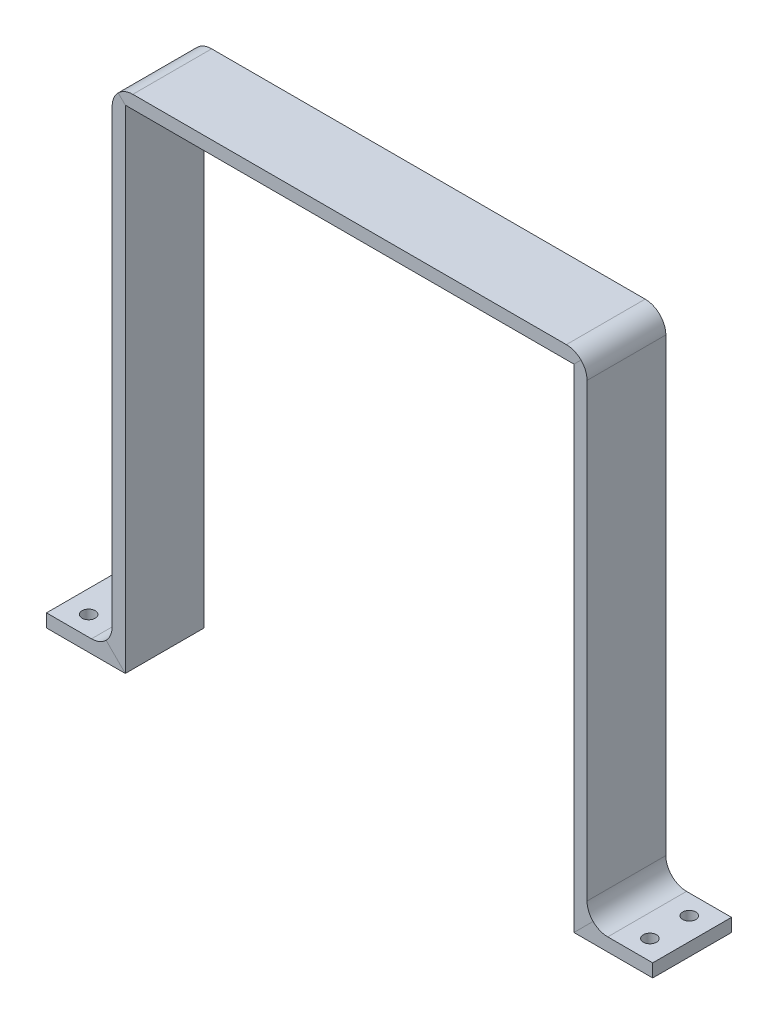
from build123d import *

# Parameters (mm, degrees)
SKETCH2_W            = 38.1
SKETCH2_H            = 6.35
FILLET1_R            = 10
CUT_EXTRUDE1_REACH   = 284.088
SKETCH3_R            = 3.175
FILLET1_OF_MIRROR1_R = 10


with BuildPart() as part:
    # Sweep1: sweep along a path in Sketch1
    with BuildLine(Plane.XY) as sweep1_path:
        Line((0, 0), (38.1, 0))
        Line((38.1, 0), (38.1, 237.998))
        Line((38.1, 237.998), (146.558, 237.998))
    # Sketch2 → Sweep1 (sweep)
    with BuildSketch(Plane(origin=(0, 0, 0), x_dir=(0, 0, -1), z_dir=(1, 0, 0))):
        with Locations((19.05, 3.175)):
            Rectangle(SKETCH2_W, SKETCH2_H)
    sweep1 = sweep(path=sweep1_path.line, transition=Transition.RIGHT)

    # Fillet1
    fillet1_edges = [part.edges().sort_by_distance(p)[0] for p in [
        (31.75, 6.35, -19.05),
        (31.75, 244.348, -19.05),
    ]]
    fillet(fillet1_edges, radius=FILLET1_R)

    # Sketch3 → Cut-Extrude1 (cut, up to next)
    with BuildSketch(Plane(origin=(0, 6.35, 0), x_dir=(1, 0, 0), z_dir=(0, 1, 0)), mode=Mode.PRIVATE) as cut_extrude1_sk1:
        with Locations((10.875, 28.575)):
            Circle(SKETCH3_R)
    cut_extrude1_tool1 = extrude(cut_extrude1_sk1.sketch, amount=-CUT_EXTRUDE1_REACH, mode=Mode.PRIVATE) & part.part
    # Sketch3 → Cut-Extrude1 (cut, up to next)
    with BuildSketch(Plane(origin=(0, 6.35, 0), x_dir=(1, 0, 0), z_dir=(0, 1, 0)), mode=Mode.PRIVATE) as cut_extrude1_sk2:
        with Locations((10.875, 9.525)):
            Circle(SKETCH3_R)
    cut_extrude1_tool2 = extrude(cut_extrude1_sk2.sketch, amount=-CUT_EXTRUDE1_REACH, mode=Mode.PRIVATE) & part.part
    cut_extrude1_1 = cut_extrude1_tool1.solids().sort_by_distance((10.875, 6.35, -28.575))[0]
    add(cut_extrude1_1, mode=Mode.SUBTRACT)
    cut_extrude1_2 = cut_extrude1_tool2.solids().sort_by_distance((10.875, 6.35, -9.525))[0]
    add(cut_extrude1_2, mode=Mode.SUBTRACT)
    cut_extrude1 = cut_extrude1_1 + cut_extrude1_2  # Cut-Extrude1 as one shape, for the pattern or mirror that repeats it

    # Mirror1: Sweep1, Cut-Extrude1 across plane
    add(sweep1.mirror(Plane(origin=(146.558, 237.998, 0), x_dir=(0, 0, 1), z_dir=(-1, 0, 0))))
    add(cut_extrude1.mirror(Plane(origin=(146.558, 237.998, 0), x_dir=(0, 0, 1), z_dir=(-1, 0, 0))), mode=Mode.SUBTRACT)

    # Fillet1 of Mirror1
    fillet1_of_mirror1_edges = [part.edges().sort_by_distance(p)[0] for p in [
        (261.366, 6.35, -19.05),
        (261.366, 244.348, -19.05),
    ]]
    fillet(fillet1_of_mirror1_edges, radius=FILLET1_OF_MIRROR1_R)


solid = part.part
